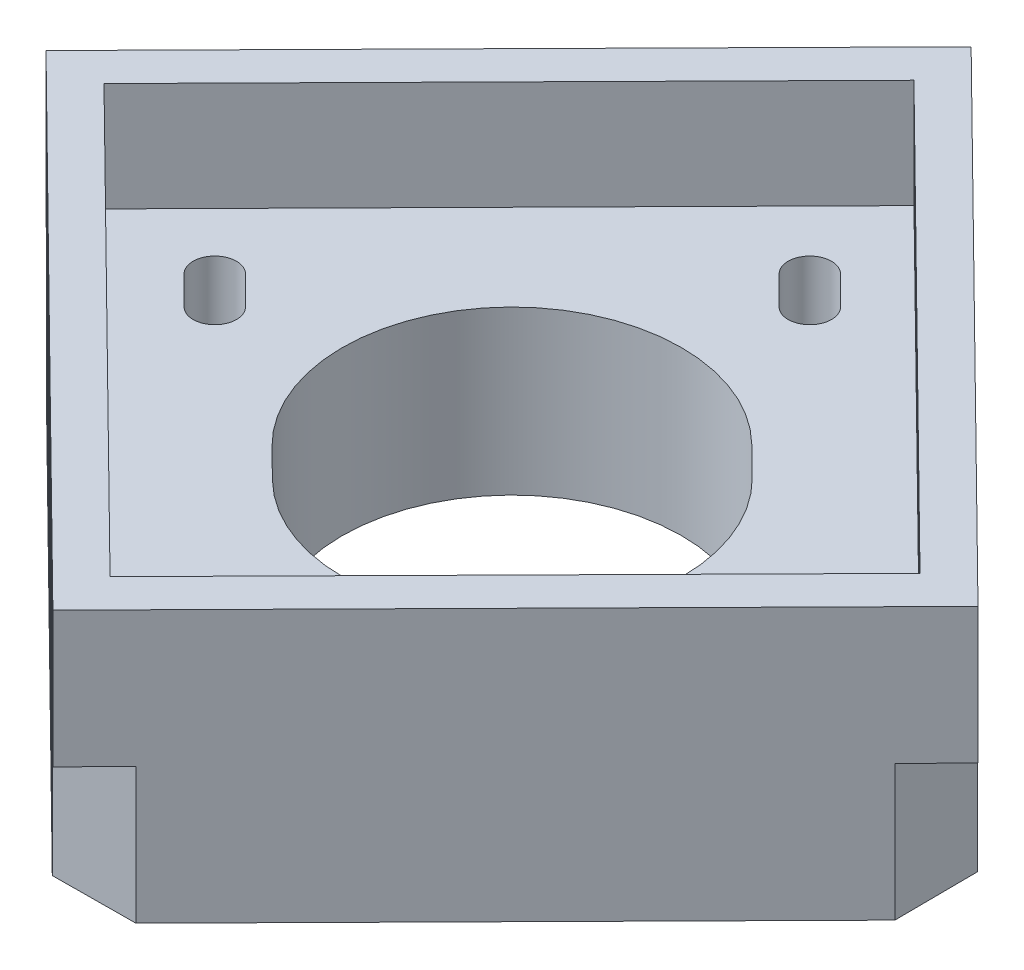
from build123d import *

# Parameters (mm, degrees)
SKETCH1_W                  = 215
SKETCH1_H                  = 140
BOSS_EXTRUDE1_DEPTH        = 10
FILLET1_R                  = 60
SKETCH2_R                  = 20
SKETCH2_R_2                = 7.5
CUT_EXTRUDE1_DEPTH         = 129.671092325
CUT_EXTRUDE2_DEPTH         = 129.671092325
CUT_EXTRUDE3_DEPTH         = 129.671092325
SKETCH5_R                  = 11
CUT_EXTRUDE4_DEPTH         = 7
SKETCH6_R                  = 14
SKETCH6_R_2                = 11
BOSS_EXTRUDE2_DEPTH        = 8.5
SKETCH7_R                  = 23.5
CUT_EXTRUDE5_DEPTH         = 7
SKETCH8_R                  = 38.5
SKETCH8_R_2                = 30.5
BOSS_EXTRUDE3_DEPTH        = 8
BOSS_EXTRUDE4_DEPTH        = 35
BOSS_EXTRUDE5_DEPTH        = 8
CUT_EXTRUDE6_DEPTH         = 8
SKETCH12_R                 = 11
SKETCH12_R_2               = 7.5
BOSS_EXTRUDE6_DEPTH        = 0.5
BOSS_EXTRUDE7_REACH        = 137.946
SKETCH14_R                 = 2.05
CUT_EXTRUDE7_DEPTH         = 3.6
BOSS_EXTRUDE8_REACH        = 137.946
SKETCH16_R                 = 2.05
CUT_EXTRUDE8_START         = -3.6
CUT_EXTRUDE8_OUTLINE_R     = 2.05
CUT_EXTRUDE8_DEPTH         = 3.6
LPATTERN1_COUNT            = 3
LPATTERN1_PITCH            = 55
MIRROR2_COPY_1_REACH       = 137.946
MIRROR2_COPY_1_SKETCH_R    = 2.05
MIRROR2_COPY_2_REACH       = 137.946
MIRROR2_COPY_2_SKETCH_R    = 2.05
MIRROR2_START              = -3.6
MIRROR2_COPY_3_SKETCH_R    = 2.05
MIRROR2_COPY_3_DEPTH       = 3.6
MIRROR2_COPY_4_SKETCH_R    = 2.05
MIRROR2_COPY_4_DEPTH       = 3.6
BOSS_EXTRUDE9_REACH        = 137.946
SKETCH18_R                 = 2.05
CUT_EXTRUDE9_DEPTH         = 3.6
BOSS_EXTRUDE10_DEPTH       = 8
CUT_EXTRUDE10_DEPTH        = 133.97086147
SKETCH22_R                 = 1.6
CUT_EXTRUDE11_DEPTH        = 133.97086147
SKETCH23_R                 = 2.05
CUT_EXTRUDE12_DEPTH        = 133.97086147
CUT_EXTRUDE13_REACH        = 230.801
SKETCH24_R                 = 2.05
CROQUIS1_OUTSIDE_W         = 269.096
CROQUIS1_OUTSIDE_H         = 194.096
CORTAR_EXTRUIR1_DEPTH      = 136.945761243
CORTAR_EXTRUIR2_DEPTH      = 131.754479901
CORTAR_EXTRUIR2_DEPTH_BACK = 131.754479901
CROQUIS2_OUTSIDE_W         = 122.389
CROQUIS2_OUTSIDE_H         = 68.694
CROQUIS2_OUTSIDE_W_2       = 50.5
CROQUIS2_OUTSIDE_H_2       = 18
CORTAR_EXTRUIR3_DEPTH      = 128.426864322
CORTAR_EXTRUIR3_DEPTH_BACK = 8
CROQUIS3_OUTSIDE_W         = 91.868
CROQUIS3_OUTSIDE_H         = 91.844
SALIENTE_EXTRUIR1_DEPTH    = 2


# Read off the part's stored shape, not the designer's step: Cut-Extrude8
with BuildPart() as part:
    # Sketch1 → Boss-Extrude1 (new body)
    with BuildSketch(Plane(origin=(0, 0, 0), x_dir=(1, 0, 0), z_dir=(0, 1, 0))):
        Rectangle(SKETCH1_W, SKETCH1_H)
    extrude(amount=BOSS_EXTRUDE1_DEPTH)

    # Fillet1
    fillet1_edges = [part.edges().sort_by_distance(p)[0] for p in [
        (107.5, 5, 70),
        (107.5, 5, -70),
    ]]
    fillet(fillet1_edges, radius=FILLET1_R)

    # Sketch2 → Cut-Extrude1 (cut, through all)
    with BuildSketch(Plane(origin=(0, 10, 0), x_dir=(1, 0, 0), z_dir=(0, 1, 0))):
        with Locations(Location((42.5, 0, 0), (0, 0, 270))):
            Circle(SKETCH2_R)
        with Locations(Location((-36.5, 0, 0), (0, 0, 270))):
            Circle(SKETCH2_R_2)
    extrude(amount=-CUT_EXTRUDE1_DEPTH, mode=Mode.SUBTRACT)

    # Sketch3 → Cut-Extrude2 (cut, through all)
    with BuildSketch(Plane(origin=(0, 10, 0), x_dir=(1, 0, 0), z_dir=(0, 1, 0))):
        with BuildLine():
            Line((-62.6171596, 43.302932631), (-60.480848158, 41.196710083))
            ThreePointArc((-60.480848158, 41.196710083), (-60.355477768, 23.519485123), (-78.032702727, 23.394114734))
            Line((-78.032702727, 23.394114734), (-80.169014169, 25.500337282))
            ThreePointArc((-80.169014169, 25.500337282), (-80.294384559, 43.177562241), (-62.6171596, 43.302932631))
        make_face()
    extrude(amount=-CUT_EXTRUDE2_DEPTH, mode=Mode.SUBTRACT)

    # Sketch4 → Cut-Extrude3 (cut, through all)
    with BuildSketch(Plane(origin=(0, 10, 0), x_dir=(1, 0, 0), z_dir=(0, 1, 0))):
        with BuildLine():
            Line((-48.467836076, 31.164041558), (-50.589156419, 33.285361902))
            ThreePointArc((-50.589156419, 33.285361902), (-50.589156419, 35.548103602), (-48.326414719, 35.548103602))
            Line((-48.326414719, 35.548103602), (-46.205094376, 33.426783258))
            ThreePointArc((-46.205094376, 33.426783258), (-46.205094376, 31.164041558), (-48.467836076, 31.164041558))
        make_face()
        with BuildLine():
            Line((-70.388146292, 53.084351775), (-72.509466636, 55.205672119))
            ThreePointArc((-72.509466636, 55.205672119), (-72.509466636, 57.468413818), (-70.246724936, 57.468413818))
            Line((-70.246724936, 57.468413818), (-68.125404593, 55.347093475))
            ThreePointArc((-68.125404593, 55.347093475), (-68.125404593, 53.084351775), (-70.388146292, 53.084351775))
        make_face()
        with BuildLine():
            Line((-70.388146292, 9.243731341), (-72.509466636, 11.365051685))
            ThreePointArc((-72.509466636, 11.365051685), (-72.509466636, 13.627793385), (-70.246724936, 13.627793385))
            Line((-70.246724936, 13.627793385), (-68.125404593, 11.506473041))
            ThreePointArc((-68.125404593, 11.506473041), (-68.125404593, 9.243731341), (-70.388146292, 9.243731341))
        make_face()
        with BuildLine():
            Line((-92.308456509, 31.164041558), (-94.429776853, 33.285361902))
            ThreePointArc((-94.429776853, 33.285361902), (-94.429776853, 35.548103602), (-92.167035153, 35.548103602))
            Line((-92.167035153, 35.548103602), (-90.045714809, 33.426783258))
            ThreePointArc((-90.045714809, 33.426783258), (-90.045714809, 31.164041558), (-92.308456509, 31.164041558))
        make_face()
    extrude(amount=-CUT_EXTRUDE3_DEPTH, mode=Mode.SUBTRACT)

    # Sketch5 → Cut-Extrude4 (cut)
    with BuildSketch(Plane(origin=(0, 10, 0), x_dir=(1, 0, 0), z_dir=(0, 1, 0))):
        with Locations(Location((-36.5, 0, 0), (0, 0, 270))):
            Circle(SKETCH5_R)
    extrude(amount=-CUT_EXTRUDE4_DEPTH, mode=Mode.SUBTRACT)

    # Sketch6 → Boss-Extrude2 (add)
    with BuildSketch(Plane.XZ):
        with Locations(Location((-36.5, 0, 0), (0, 0, 270))):
            Circle(SKETCH6_R)
        with Locations(Location((-36.5, 0, 0), (0, 0, 90))):
            Circle(SKETCH6_R_2, mode=Mode.SUBTRACT)
    extrude(amount=BOSS_EXTRUDE2_DEPTH)

    # Sketch7 → Cut-Extrude5 (cut)
    with BuildSketch(Plane.XZ):
        with Locations(Location((42.5, 0, 0), (0, 0, 270))):
            Circle(SKETCH7_R)
    extrude(amount=-CUT_EXTRUDE5_DEPTH, mode=Mode.SUBTRACT)

    # Sketch8 → Boss-Extrude3 (add)
    with BuildSketch(Plane.XZ):
        with Locations(Location((42.5, 0, 0), (0, 0, 270))):
            Circle(SKETCH8_R)
        with Locations(Location((42.5, 0, 0), (0, 0, 270))):
            Circle(SKETCH8_R_2, mode=Mode.SUBTRACT)
    extrude(amount=BOSS_EXTRUDE3_DEPTH)

    # Sketch9 → Boss-Extrude4 (add)
    with BuildSketch(Plane.XZ):
        with BuildLine():
            Line((-107.5, -70), (47.5, -70))
            ThreePointArc((47.5, -70), (89.926406871, -52.426406871), (107.5, -10))
            Line((107.5, -10), (107.5, 10))
            ThreePointArc((107.5, 10), (89.926406871, 52.426406871), (47.5, 70))
            Line((47.5, 70), (-107.5, 70))
            Line((-107.5, 70), (-107.5, -70))
        make_face()
        with BuildLine():
            Line((47.5, 62), (-99.5, 62))
            Line((-99.5, 62), (-99.5, -62))
            Line((-99.5, -62), (47.5, -62))
            ThreePointArc((47.5, -62), (84.269552622, -46.769552622), (99.5, -10))
            Line((99.5, -10), (99.5, 10))
            ThreePointArc((99.5, 10), (84.269552622, 46.769552622), (47.5, 62))
        make_face(mode=Mode.SUBTRACT)
    extrude(amount=BOSS_EXTRUDE4_DEPTH)

    # Sketch10 → Boss-Extrude5 (add)
    with BuildSketch(Plane.XZ):
        with BuildLine():
            Line((-36.5, -14), (-36.5, -62))
            Line((-36.5, -62), (-99.5, -62))
            Line((-99.5, -62), (-99.5, 0))
            Line((-99.5, 0), (-50.5, 0))
            ThreePointArc((-50.5, 0), (-46.399494937, -9.899494937), (-36.5, -14))
        make_face()
        with BuildLine():
            Line((-80.169014169, -25.500337282), (-78.032702727, -23.394114734))
            ThreePointArc((-78.032702727, -23.394114734), (-60.355477768, -23.519485123), (-60.480848158, -41.196710083))
            Line((-60.480848158, -41.196710083), (-62.6171596, -43.302932631))
            ThreePointArc((-62.6171596, -43.302932631), (-80.294384559, -43.177562241), (-80.169014169, -25.500337282))
        make_face(mode=Mode.SUBTRACT)
        with BuildLine():
            Line((-94.429776853, -33.285361902), (-92.308456509, -31.164041558))
            ThreePointArc((-92.308456509, -31.164041558), (-90.045714809, -31.164041558), (-90.045714809, -33.426783258))
            Line((-90.045714809, -33.426783258), (-92.167035153, -35.548103602))
            ThreePointArc((-92.167035153, -35.548103602), (-94.429776853, -35.548103602), (-94.429776853, -33.285361902))
        make_face(mode=Mode.SUBTRACT)
        with BuildLine():
            Line((-68.125404593, -55.347093475), (-70.246724936, -57.468413818))
            ThreePointArc((-70.246724936, -57.468413818), (-72.509466636, -57.468413818), (-72.509466636, -55.205672119))
            Line((-72.509466636, -55.205672119), (-70.388146292, -53.084351775))
            ThreePointArc((-70.388146292, -53.084351775), (-68.125404593, -53.084351775), (-68.125404593, -55.347093475))
        make_face(mode=Mode.SUBTRACT)
        with BuildLine():
            Line((-46.205094376, -33.426783258), (-48.326414719, -35.548103602))
            ThreePointArc((-48.326414719, -35.548103602), (-50.589156419, -35.548103602), (-50.589156419, -33.285361902))
            Line((-50.589156419, -33.285361902), (-48.467836076, -31.164041558))
            ThreePointArc((-48.467836076, -31.164041558), (-46.205094376, -31.164041558), (-46.205094376, -33.426783258))
        make_face(mode=Mode.SUBTRACT)
        with BuildLine():
            Line((-68.125404593, -11.506473041), (-70.246724936, -13.627793385))
            ThreePointArc((-70.246724936, -13.627793385), (-72.509466636, -13.627793385), (-72.509466636, -11.365051685))
            Line((-72.509466636, -11.365051685), (-70.388146292, -9.243731341))
            ThreePointArc((-70.388146292, -9.243731341), (-68.125404593, -9.243731341), (-68.125404593, -11.506473041))
        make_face(mode=Mode.SUBTRACT)
    extrude(amount=BOSS_EXTRUDE5_DEPTH)

    # Sketch11 → Cut-Extrude6 (cut)
    with BuildSketch(Plane(origin=(0, 10, 0), x_dir=(1, 0, 0), z_dir=(0, 1, 0))):
        Polygon((-101.517084141, 34.470839412), (-71.889553628, 64.521620361), (-40.200933906, 33.279319227), (-69.82846442, 3.228538278), align=None)
    extrude(amount=-CUT_EXTRUDE6_DEPTH, mode=Mode.SUBTRACT)

    # Sketch12 → Boss-Extrude6 (add)
    with BuildSketch(Plane.XZ):
        with Locations(Location((-36.5, 0, 0), (0, 0, 90))):
            Circle(SKETCH12_R)
        with Locations(Location((-36.5, 0, 0), (0, 0, 90))):
            Circle(SKETCH12_R_2, mode=Mode.SUBTRACT)
    extrude(amount=BOSS_EXTRUDE6_DEPTH)

    # Sketch14 → Boss-Extrude7 (add, up to next)
    with BuildSketch(Plane.XZ.offset(35), mode=Mode.PRIVATE) as boss_extrude7_sk1:
        with BuildLine():
            Line((61.391194045, 60.110225783), (60.333474536, 57.556665))
            ThreePointArc((60.333474536, 57.556665), (63.337112892, 50.305240545), (70.588537347, 53.308878901))
            Line((70.588537347, 53.308878901), (71.711379603, 56.019659904))
            ThreePointArc((71.711379603, 56.019659904), (66.660759692, 58.341134534), (61.391194045, 60.110225783))
        make_face()
        with Locations(Location((65.461005942, 55.432771951, 0), (0, 0, 270))):
            Circle(SKETCH14_R, mode=Mode.SUBTRACT)
    boss_extrude7_tool1 = extrude(boss_extrude7_sk1.sketch, amount=-BOSS_EXTRUDE7_REACH, mode=Mode.PRIVATE) - part.part
    # Sketch14 → Boss-Extrude7 (add, up to next)
    with BuildSketch(Plane.XZ.offset(35), mode=Mode.PRIVATE) as boss_extrude7_sk2:
        with BuildLine():
            ThreePointArc((98.972980454, 17.3845977), (97.876725035, 22.891298414), (96.193134966, 28.247701421))
            Line((96.193134966, 28.247701421), (93.037240304, 26.94048705))
            ThreePointArc((93.037240304, 26.94048705), (90.033601948, 19.689062595), (97.285026403, 16.685424239))
            Line((97.285026403, 16.685424239), (98.972980454, 17.3845977))
        make_face()
        with Locations(Location((95.161133353, 21.812955645, 0), (0, 0, 270))):
            Circle(SKETCH14_R, mode=Mode.SUBTRACT)
    boss_extrude7_tool2 = extrude(boss_extrude7_sk2.sketch, amount=-BOSS_EXTRUDE7_REACH, mode=Mode.PRIVATE) - part.part
    boss_extrude7_1 = boss_extrude7_tool1.solids().sort_by_distance((61.006604, -35, 58.773687))[0]
    add(boss_extrude7_1)
    boss_extrude7_2 = boss_extrude7_tool2.solids().sort_by_distance((97.729394, -35, 22.853597))[0]
    add(boss_extrude7_2)
    boss_extrude7 = boss_extrude7_1 + boss_extrude7_2  # Boss-Extrude7 as one shape, for the pattern or mirror that repeats it

    # Sketch15 → Cut-Extrude7 (cut)
    with BuildSketch(Plane(origin=(0, -25, 0), x_dir=(-1, 0, 0), z_dir=(0, -1, 0))):
        with BuildLine():
            Line((-92.636291132, -16.870519833), (-98.459041258, -19.282381905))
            Line((-98.459041258, -19.282381905), (-99.00162845, -23.4037408))
            Line((-99.00162845, -23.4037408), (-95.703720545, -25.93431454))
            Line((-95.703720545, -25.93431454), (-89.880970419, -23.522452467))
            ThreePointArc((-89.880970419, -23.522452467), (-90.033601948, -19.689062595), (-92.636291132, -16.870519833))
        make_face()
        with BuildLine():
            Line((-67.170502764, -50.152609016), (-69.582364837, -55.975359143))
            Line((-69.582364837, -55.975359143), (-67.051791097, -59.273267048))
            Line((-67.051791097, -59.273267048), (-62.930432203, -58.730679856))
            Line((-62.930432203, -58.730679856), (-60.51857013, -52.907929729))
            ThreePointArc((-60.51857013, -52.907929729), (-63.337112892, -50.305240545), (-67.170502764, -50.152609016))
        make_face()
    cut_extrude7 = extrude(amount=-CUT_EXTRUDE7_DEPTH, mode=Mode.SUBTRACT)

    # Mirror1: Boss-Extrude7, Cut-Extrude7 across plane
    add(boss_extrude7.mirror(Plane.XY))
    add(cut_extrude7.mirror(Plane.XY), mode=Mode.SUBTRACT)

    # Sketch16 → Boss-Extrude8 (add, up to next)
    with BuildSketch(Plane.XZ.offset(35), mode=Mode.PRIVATE) as boss_extrude8_sk1:
        with BuildLine():
            Line((16.95, 59), (16.95, 62))
            Line((16.95, 62), (28.05, 62))
            Line((28.05, 62), (28.05, 59))
            ThreePointArc((28.05, 59), (22.5, 53.45), (16.95, 59))
        make_face()
        with Locations(Location((22.5, 59, 0), (0, 0, 270))):
            Circle(SKETCH16_R, mode=Mode.SUBTRACT)
    boss_extrude8_tool1 = extrude(boss_extrude8_sk1.sketch, amount=-BOSS_EXTRUDE8_REACH, mode=Mode.PRIVATE) - part.part
    boss_extrude8 = boss_extrude8_tool1.solids().sort_by_distance((17.090112, -35, 60.5))[0]
    add(boss_extrude8)

    # Cut-Extrude8 outline → Cut-Extrude8 (cut)
    with BuildSketch(Plane(origin=(0, -25, 0), x_dir=(-1, 0, 0), z_dir=(0, -1, 0)).offset(CUT_EXTRUDE8_START)):
        with BuildLine():
            Line((-22.5, -63.156921938), (-18.9, -61.078460969))
            Line((-18.9, -61.078460969), (-18.9, -54.775961648))
            ThreePointArc((-18.9, -54.775961648), (-22.5, -53.45), (-26.1, -54.775961648))
            Line((-26.1, -54.775961648), (-26.1, -61.078460969))
            Line((-26.1, -61.078460969), (-22.5, -63.156921938))
        make_face()
        with Locations((-22.5, -59)):
            Circle(CUT_EXTRUDE8_OUTLINE_R, mode=Mode.SUBTRACT)
    cut_extrude8 = extrude(amount=CUT_EXTRUDE8_DEPTH, mode=Mode.SUBTRACT)

    # LPattern1: Boss-Extrude8, Cut-Extrude8 ×3
    with Locations(*[(-i * LPATTERN1_PITCH, 0, 0) for i in range(1, LPATTERN1_COUNT)]):
        add(boss_extrude8)
        add(cut_extrude8, mode=Mode.SUBTRACT)

    # Mirror2: Boss-Extrude8, Cut-Extrude8 across plane
    add(boss_extrude8.mirror(Plane.XY))
    add(cut_extrude8.mirror(Plane.XY), mode=Mode.SUBTRACT)

    # Mirror2 copy 1 sketch → Mirror2 copy 1 (add, up to next)
    with BuildSketch(Plane(origin=(-55, -35, 0), x_dir=(1, 0, 0), z_dir=(0, -1, 0)), mode=Mode.PRIVATE) as mirror2_copy_1_sk1:
        with BuildLine():
            Line((16.95, -59), (16.95, -62))
            Line((16.95, -62), (28.05, -62))
            Line((28.05, -62), (28.05, -59))
            ThreePointArc((28.05, -59), (22.5, -53.45), (16.95, -59))
        make_face()
        with Locations((22.5, -59)):
            Circle(MIRROR2_COPY_1_SKETCH_R, mode=Mode.SUBTRACT)
    mirror2_copy_1_tool1 = extrude(mirror2_copy_1_sk1.sketch, amount=-MIRROR2_COPY_1_REACH, mode=Mode.PRIVATE) - part.part
    add(mirror2_copy_1_tool1.solids().sort_by_distance((-37.909888, -35, -60.5))[0])

    # Mirror2 copy 2 sketch → Mirror2 copy 2 (add, up to next)
    with BuildSketch(Plane(origin=(-110, -35, 0), x_dir=(1, 0, 0), z_dir=(0, -1, 0)), mode=Mode.PRIVATE) as mirror2_copy_2_sk1:
        with BuildLine():
            Line((16.95, -59), (16.95, -62))
            Line((16.95, -62), (28.05, -62))
            Line((28.05, -62), (28.05, -59))
            ThreePointArc((28.05, -59), (22.5, -53.45), (16.95, -59))
        make_face()
        with Locations((22.5, -59)):
            Circle(MIRROR2_COPY_2_SKETCH_R, mode=Mode.SUBTRACT)
    mirror2_copy_2_tool1 = extrude(mirror2_copy_2_sk1.sketch, amount=-MIRROR2_COPY_2_REACH, mode=Mode.PRIVATE) - part.part
    add(mirror2_copy_2_tool1.solids().sort_by_distance((-92.909888, -35, -60.5))[0])

    # Mirror2 copy 3 sketch → Mirror2 copy 3 (cut)
    with BuildSketch(Plane(origin=(-55, -25, 0), x_dir=(-1, 0, 0), z_dir=(0, -1, 0)).offset(MIRROR2_START)):
        with BuildLine():
            Line((-22.5, 63.156921938), (-18.9, 61.078460969))
            Line((-18.9, 61.078460969), (-18.9, 54.775961648))
            ThreePointArc((-18.9, 54.775961648), (-22.5, 53.45), (-26.1, 54.775961648))
            Line((-26.1, 54.775961648), (-26.1, 61.078460969))
            Line((-26.1, 61.078460969), (-22.5, 63.156921938))
        make_face()
        with Locations((-22.5, 59)):
            Circle(MIRROR2_COPY_3_SKETCH_R, mode=Mode.SUBTRACT)
    extrude(amount=MIRROR2_COPY_3_DEPTH, mode=Mode.SUBTRACT)

    # Mirror2 copy 4 sketch → Mirror2 copy 4 (cut)
    with BuildSketch(Plane(origin=(-110, -25, 0), x_dir=(-1, 0, 0), z_dir=(0, -1, 0)).offset(MIRROR2_START)):
        with BuildLine():
            Line((-22.5, 63.156921938), (-18.9, 61.078460969))
            Line((-18.9, 61.078460969), (-18.9, 54.775961648))
            ThreePointArc((-18.9, 54.775961648), (-22.5, 53.45), (-26.1, 54.775961648))
            Line((-26.1, 54.775961648), (-26.1, 61.078460969))
            Line((-26.1, 61.078460969), (-22.5, 63.156921938))
        make_face()
        with Locations((-22.5, 59)):
            Circle(MIRROR2_COPY_4_SKETCH_R, mode=Mode.SUBTRACT)
    extrude(amount=MIRROR2_COPY_4_DEPTH, mode=Mode.SUBTRACT)

    # Sketch18 → Boss-Extrude9 (add, up to next)
    with BuildSketch(Plane.XZ.offset(35), mode=Mode.PRIVATE) as boss_extrude9_sk1:
        with BuildLine():
            Line((-96.5, 28.55), (-99.5, 28.55))
            Line((-99.5, 28.55), (-99.5, 17.45))
            Line((-99.5, 17.45), (-96.5, 17.45))
            ThreePointArc((-96.5, 17.45), (-90.95, 23), (-96.5, 28.55))
        make_face()
        with Locations(Location((-96.5, 23, 0), (0, 0, 270))):
            Circle(SKETCH18_R, mode=Mode.SUBTRACT)
    boss_extrude9_tool1 = extrude(boss_extrude9_sk1.sketch, amount=-BOSS_EXTRUDE9_REACH, mode=Mode.PRIVATE) - part.part
    boss_extrude9 = boss_extrude9_tool1.solids().sort_by_distance((-98, -35, 28.409888))[0]
    add(boss_extrude9)

    # Sketch19 → Cut-Extrude9 (cut)
    with BuildSketch(Plane(origin=(0, -25, 0), x_dir=(-1, 0, 0), z_dir=(0, -1, 0))):
        with BuildLine():
            Line((98.578460969, -19.4), (92.275961648, -19.4))
            ThreePointArc((92.275961648, -19.4), (90.95, -23), (92.275961648, -26.6))
            Line((92.275961648, -26.6), (98.578460969, -26.6))
            Line((98.578460969, -26.6), (100.656921938, -23))
            Line((100.656921938, -23), (98.578460969, -19.4))
        make_face()
    cut_extrude9 = extrude(amount=-CUT_EXTRUDE9_DEPTH, mode=Mode.SUBTRACT)

    # Mirror3: Boss-Extrude9, Cut-Extrude9 across plane
    add(boss_extrude9.mirror(Plane.XY))
    add(cut_extrude9.mirror(Plane.XY), mode=Mode.SUBTRACT)

    # Sketch20 → Boss-Extrude10 (add)
    with BuildSketch(Plane.XZ):
        with BuildLine():
            Line((-25.156854249, 62), (12.595291742, 24.247854008))
            ThreePointArc((12.595291742, 24.247854008), (15.276388924, 27.223611076), (18.252145992, 29.904708258))
            Line((18.252145992, 29.904708258), (-13.843145751, 62))
            Line((-13.843145751, 62), (-25.156854249, 62))
        make_face()
        with BuildLine():
            Line((38.5, 62), (38.5, 38.291643997))
            ThreePointArc((38.5, 38.291643997), (42.5, 38.5), (46.5, 38.291643997))
            Line((46.5, 38.291643997), (46.5, 62))
            Line((46.5, 62), (38.5, 62))
        make_face()
        with BuildLine():
            Line((83.939658706, 47.096512955), (66.747854008, 29.904708258))
            ThreePointArc((66.747854008, 29.904708258), (69.723611076, 27.223611076), (72.404708258, 24.247854008))
            Line((72.404708258, 24.247854008), (89.209849092, 41.052994843))
            ThreePointArc((89.209849092, 41.052994843), (86.691420235, 44.176491627), (83.939658706, 47.096512955))
        make_face()
        with BuildLine():
            ThreePointArc((81, 0), (80.947875714, -2.002711426), (80.791643997, -4))
            Line((80.791643997, -4), (99.5, -4))
            Line((99.5, -4), (99.5, 4))
            Line((99.5, 4), (80.791643997, 4))
            ThreePointArc((80.791643997, 4), (80.947875714, 2.002711426), (81, 0))
        make_face()
        with BuildLine():
            ThreePointArc((72.404708258, -24.247854008), (69.723611076, -27.223611076), (66.747854008, -29.904708258))
            Line((66.747854008, -29.904708258), (83.939658706, -47.096512955))
            ThreePointArc((83.939658706, -47.096512955), (86.691420235, -44.176491627), (89.209849092, -41.052994843))
            Line((89.209849092, -41.052994843), (72.404708258, -24.247854008))
        make_face()
        with BuildLine():
            ThreePointArc((46.5, -38.291643997), (42.5, -38.5), (38.5, -38.291643997))
            Line((38.5, -38.291643997), (38.5, -62))
            Line((38.5, -62), (46.5, -62))
            Line((46.5, -62), (46.5, -38.291643997))
        make_face()
        with BuildLine():
            Line((12.595291742, -24.247854008), (-25.156854249, -62))
            Line((-25.156854249, -62), (-13.843145751, -62))
            Line((-13.843145751, -62), (18.252145992, -29.904708258))
            ThreePointArc((18.252145992, -29.904708258), (15.276388924, -27.223611076), (12.595291742, -24.247854008))
        make_face()
    extrude(amount=BOSS_EXTRUDE10_DEPTH)

    # Sketch21 → Cut-Extrude10 (cut, through all)
    with BuildSketch(Plane.XZ):
        with BuildLine():
            Line((-5, 12), (-5, 24))
            ThreePointArc((-5, 24), (-2.5, 26.5), (0, 24))
            Line((0, 24), (0, 12))
            ThreePointArc((0, 12), (-2.5, 9.5), (-5, 12))
        make_face()
        with BuildLine():
            Line((0, -12), (0, -24))
            ThreePointArc((0, -24), (-2.5, -26.5), (-5, -24))
            Line((-5, -24), (-5, -12))
            ThreePointArc((-5, -12), (-2.5, -9.5), (0, -12))
        make_face()
    extrude(amount=-CUT_EXTRUDE10_DEPTH, mode=Mode.SUBTRACT)

    # Sketch22 → Cut-Extrude11 (cut, through all)
    with BuildSketch(Plane.XZ):
        with Locations(Location((-5.5, -2, 0), (0, 0, 270))):
            Circle(SKETCH22_R)
        with Locations(Location((-13.888002132, 2.459979846, 0), (0, 0, 270))):
            Circle(SKETCH22_R)
    extrude(amount=-CUT_EXTRUDE11_DEPTH, mode=Mode.SUBTRACT)

    # Sketch23 → Cut-Extrude12 (cut, through all)
    with BuildSketch(Plane.XZ):
        with Locations(Location((-87.5, 8, 0), (0, 0, 270))):
            Circle(SKETCH23_R)
        with Locations(Location((-75.5, 8, 0), (0, 0, 270))):
            Circle(SKETCH23_R)
        with Locations(Location((-28.5, -36, 0), (0, 0, 270))):
            Circle(SKETCH23_R)
        with Locations(Location((-28.5, -48, 0), (0, 0, 270))):
            Circle(SKETCH23_R)
        with Locations(Location((-16.5, -42, 0), (0, 0, 270))):
            Circle(SKETCH23_R)
    extrude(amount=-CUT_EXTRUDE12_DEPTH, mode=Mode.SUBTRACT)

    # Sketch24 → Cut-Extrude13 (cut, up to next)
    with BuildSketch(Plane.ZY.offset(107.5), mode=Mode.PRIVATE) as cut_extrude13_sk1:
        with Locations((0, -27)):
            Circle(SKETCH24_R)
    cut_extrude13_tool1 = extrude(cut_extrude13_sk1.sketch, amount=-CUT_EXTRUDE13_REACH, mode=Mode.PRIVATE) & part.part
    # Sketch24 → Cut-Extrude13 (cut, up to next)
    with BuildSketch(Plane.ZY.offset(107.5), mode=Mode.PRIVATE) as cut_extrude13_sk2:
        with Locations((0, -13)):
            Circle(SKETCH24_R)
    cut_extrude13_tool2 = extrude(cut_extrude13_sk2.sketch, amount=-CUT_EXTRUDE13_REACH, mode=Mode.PRIVATE) & part.part
    # Sketch24 → Cut-Extrude13 (cut, up to next)
    with BuildSketch(Plane.ZY.offset(107.5), mode=Mode.PRIVATE) as cut_extrude13_sk3:
        with Locations((-50, -13)):
            Circle(SKETCH24_R)
    cut_extrude13_tool3 = extrude(cut_extrude13_sk3.sketch, amount=-CUT_EXTRUDE13_REACH, mode=Mode.PRIVATE) & part.part
    # Sketch24 → Cut-Extrude13 (cut, up to next)
    with BuildSketch(Plane.ZY.offset(107.5), mode=Mode.PRIVATE) as cut_extrude13_sk4:
        with Locations((-50, -27)):
            Circle(SKETCH24_R)
    cut_extrude13_tool4 = extrude(cut_extrude13_sk4.sketch, amount=-CUT_EXTRUDE13_REACH, mode=Mode.PRIVATE) & part.part
    # Sketch24 → Cut-Extrude13 (cut, up to next)
    with BuildSketch(Plane.ZY.offset(107.5), mode=Mode.PRIVATE) as cut_extrude13_sk5:
        with Locations((50, -13)):
            Circle(SKETCH24_R)
    cut_extrude13_tool5 = extrude(cut_extrude13_sk5.sketch, amount=-CUT_EXTRUDE13_REACH, mode=Mode.PRIVATE) & part.part
    # Sketch24 → Cut-Extrude13 (cut, up to next)
    with BuildSketch(Plane.ZY.offset(107.5), mode=Mode.PRIVATE) as cut_extrude13_sk6:
        with Locations((50, -27)):
            Circle(SKETCH24_R)
    cut_extrude13_tool6 = extrude(cut_extrude13_sk6.sketch, amount=-CUT_EXTRUDE13_REACH, mode=Mode.PRIVATE) & part.part
    add(cut_extrude13_tool1.solids().sort_by_distance((-107.5, -27, 0))[0], mode=Mode.SUBTRACT)
    add(cut_extrude13_tool2.solids().sort_by_distance((-107.5, -13, 0))[0], mode=Mode.SUBTRACT)
    add(cut_extrude13_tool3.solids().sort_by_distance((-107.5, -13, -50))[0], mode=Mode.SUBTRACT)
    add(cut_extrude13_tool4.solids().sort_by_distance((-107.5, -27, -50))[0], mode=Mode.SUBTRACT)
    add(cut_extrude13_tool5.solids().sort_by_distance((-107.5, -13, 50))[0], mode=Mode.SUBTRACT)
    add(cut_extrude13_tool6.solids().sort_by_distance((-107.5, -27, 50))[0], mode=Mode.SUBTRACT)

    # Croquis1 outside → Cortar-Extruir1 (cut, through all)
    with BuildSketch(Plane(origin=(0, 10, 0), x_dir=(1, 0, 0), z_dir=(0, 1, 0))):
        Rectangle(CROQUIS1_OUTSIDE_W, CROQUIS1_OUTSIDE_H)
        Polygon((-35.958399916, 33.309408121), (-71.919642521, 68.764154351), (-105.759618132, 34.440750518), (-69.798375526, -1.013995713), align=None, mode=Mode.SUBTRACT)
    extrude(amount=-CORTAR_EXTRUIR1_DEPTH, mode=Mode.SUBTRACT)

    # Croquis2 outside → Cortar-Extruir2 (cut, two sides: drawn at the far end of the back side and taken through both)
    with BuildSketch(Plane(origin=(-34.911135577, 0, 35.409866085), x_dir=(0.712103813967469, 0, 0.7020741827848282), z_dir=(-0.7020741827848282, 0, 0.712103813967469)).offset(-CORTAR_EXTRUIR2_DEPTH_BACK)):
        with Locations((-74.2415, -12.5)):
            Rectangle(CROQUIS2_OUTSIDE_W, CROQUIS2_OUTSIDE_H)
        with Locations((-74.24178921, 1)):
            Rectangle(CROQUIS2_OUTSIDE_W_2, CROQUIS2_OUTSIDE_H_2, mode=Mode.SUBTRACT)
    extrude(amount=CORTAR_EXTRUIR2_DEPTH + CORTAR_EXTRUIR2_DEPTH_BACK, mode=Mode.SUBTRACT)

    # Croquis3 outside → Cortar-Extruir3 (cut, two sides: drawn at the far end of the back side and taken through both)
    with BuildSketch(Plane.XZ.offset(8).offset(-CORTAR_EXTRUIR3_DEPTH_BACK)):
        with Locations((-70.859, -33.875)):
            Rectangle(CROQUIS3_OUTSIDE_W, CROQUIS3_OUTSIDE_H)
        Polygon((-74.959429756, -65.680941585), (-102.719830898, -37.523963284), (-102.676405366, -31.400963284), (-72.881588292, -2.025791521), (-66.758588292, -2.069217053), (-38.99818715, -30.226195355), (-39.041612682, -36.349195355), (-68.836429756, -65.724367117), align=None, mode=Mode.SUBTRACT)
    extrude(amount=CORTAR_EXTRUIR3_DEPTH + CORTAR_EXTRUIR3_DEPTH_BACK, mode=Mode.SUBTRACT)

    # Croquis7 → Saliente-Extruir1 (add)
    with BuildSketch(Plane.XZ.offset(8)):
        Polygon((-72.881588292, -2.025791521), (-102.676405366, -31.400963284), (-102.719830898, -37.523963284), (-74.959429756, -65.680941585), (-68.836429756, -65.724367117), (-39.041612682, -36.349195355), (-38.99818715, -30.226195355), (-66.758588292, -2.069217053), align=None)
        with BuildLine():
            ThreePointArc((-78.032702727, -23.394114734), (-60.355477768, -23.519485123), (-60.480848158, -41.196710083))
            Line((-60.480848158, -41.196710083), (-62.6171596, -43.302932631))
            ThreePointArc((-62.6171596, -43.302932631), (-80.294384559, -43.177562241), (-80.169014169, -25.500337282))
            Line((-80.169014169, -25.500337282), (-78.032702727, -23.394114734))
        make_face(mode=Mode.SUBTRACT)
        with BuildLine():
            ThreePointArc((-92.167035153, -35.548103602), (-94.429776853, -35.548103602), (-94.429776853, -33.285361902))
            Line((-94.429776853, -33.285361902), (-92.308456509, -31.164041558))
            ThreePointArc((-92.308456509, -31.164041558), (-90.045714809, -31.164041558), (-90.045714809, -33.426783258))
            Line((-90.045714809, -33.426783258), (-92.167035153, -35.548103602))
        make_face(mode=Mode.SUBTRACT)
        with BuildLine():
            ThreePointArc((-70.246724936, -57.468413818), (-72.509466636, -57.468413818), (-72.509466636, -55.205672119))
            Line((-72.509466636, -55.205672119), (-70.388146292, -53.084351775))
            ThreePointArc((-70.388146292, -53.084351775), (-68.125404593, -53.084351775), (-68.125404593, -55.347093475))
            Line((-68.125404593, -55.347093475), (-70.246724936, -57.468413818))
        make_face(mode=Mode.SUBTRACT)
        with BuildLine():
            ThreePointArc((-48.326414719, -35.548103602), (-50.589156419, -35.548103602), (-50.589156419, -33.285361902))
            Line((-50.589156419, -33.285361902), (-48.467836076, -31.164041558))
            ThreePointArc((-48.467836076, -31.164041558), (-46.205094376, -31.164041558), (-46.205094376, -33.426783258))
            Line((-46.205094376, -33.426783258), (-48.326414719, -35.548103602))
        make_face(mode=Mode.SUBTRACT)
        with BuildLine():
            ThreePointArc((-70.388146292, -9.243731341), (-68.125404593, -9.243731341), (-68.125404593, -11.506473041))
            Line((-68.125404593, -11.506473041), (-70.246724936, -13.627793385))
            ThreePointArc((-70.246724936, -13.627793385), (-72.509466636, -13.627793385), (-72.509466636, -11.365051685))
            Line((-72.509466636, -11.365051685), (-70.388146292, -9.243731341))
        make_face(mode=Mode.SUBTRACT)
    extrude(amount=SALIENTE_EXTRUIR1_DEPTH)


solid = part.part
